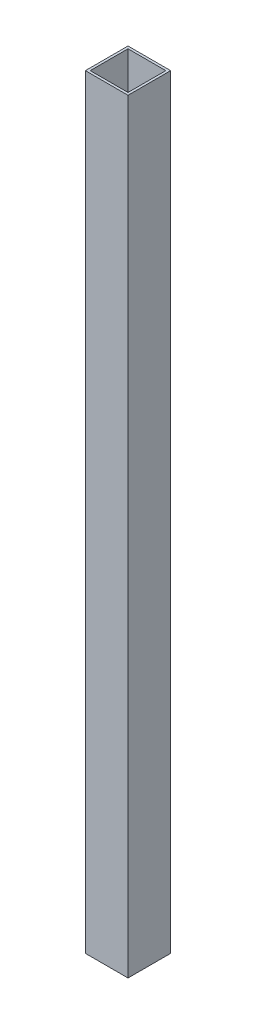
from build123d import *

# Parameters (mm, degrees)
SKETCH1_W           = 26.924
SKETCH1_H           = 26.924
SKETCH1_W_2         = 23.876
SKETCH1_H_2         = 23.876
EXTRUDE_THIN1_DEPTH = 482.6


with BuildPart() as part:
    # Sketch1 → Extrude-Thin1 (new body)
    with BuildSketch(Plane(origin=(0, 0, 0), x_dir=(1, 0, 0), z_dir=(0, 1, 0))):
        Rectangle(SKETCH1_W, SKETCH1_H)
        Rectangle(SKETCH1_W_2, SKETCH1_H_2, mode=Mode.SUBTRACT)
    extrude(amount=EXTRUDE_THIN1_DEPTH)


solid = part.part
